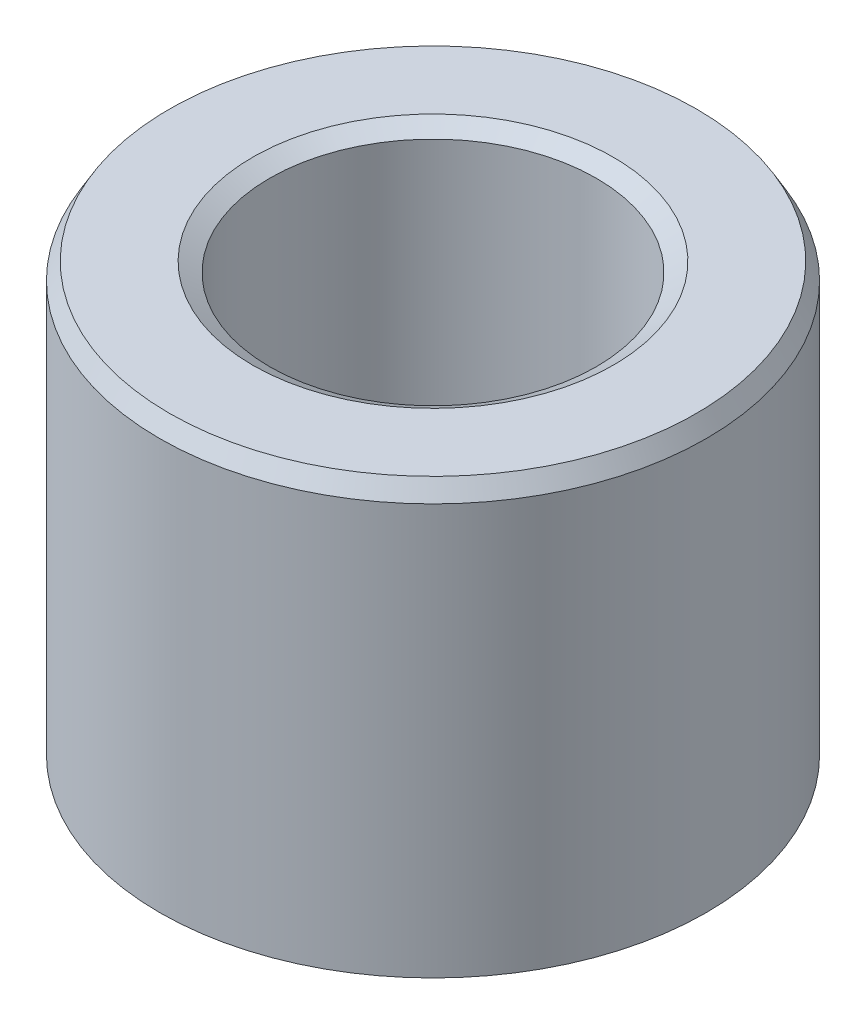
from build123d import *
from OCP.BRepFilletAPI import BRepFilletAPI_MakeChamfer

# Parameters (mm, degrees)
SKETCH1_R           = 32.5
BOSS_EXTRUDE1_DEPTH = 51.987076239
SKETCH2_R           = 19.418426335
CUT_EXTRUDE1_DEPTH  = 70.391325797
CHAMFER1_SIZE       = 2.013413369
CHAMFER1_SIZE2      = 1.162444751


with BuildPart() as part:
    # Sketch1 → Boss-Extrude1 (new body)
    with BuildSketch(Plane(origin=(0, 0, 0), x_dir=(1, 0, 0), z_dir=(0, 1, 0))):
        Circle(SKETCH1_R)
    extrude(amount=BOSS_EXTRUDE1_DEPTH)

    # Sketch2 → Cut-Extrude1 (cut, through all)
    with BuildSketch(Plane(origin=(0, 0, 0), x_dir=(1, 0, 0), z_dir=(0, 1, 0))):
        Circle(SKETCH2_R)
    extrude(amount=CUT_EXTRUDE1_DEPTH, mode=Mode.SUBTRACT)

    # Chamfer1: one chamfer whose edges measure the first distance from different faces: ONE call of the kernel's chamfer builder (chamfer() names one face for all edges)
    chamfer1_edges_1 = [part.edges().sort_by_distance(p)[0] for p in [
        (-19.418426335, 51.987076239, 0),
    ]]
    chamfer1_side_1 = [part.faces().sort_by_distance(p)[0] for p in [
        (-31.580761184, 51.987076239, 0),
    ]]
    chamfer1_edges_2 = [part.edges().sort_by_distance(p)[0] for p in [
        (-19.418426335, 0, 0),
    ]]
    chamfer1_side_2 = [part.faces().sort_by_distance(p)[0] for p in [
        (-19.418426335, 25.99353812, 0),
    ]]
    chamfer1_edges_3 = [part.edges().sort_by_distance(p)[0] for p in [
        (-32.5, 0, 0),
    ]]
    chamfer1_side_3 = [part.faces().sort_by_distance(p)[0] for p in [
        (-31.580761184, 0, 0),
    ]]
    chamfer1_edges_4 = [part.edges().sort_by_distance(p)[0] for p in [
        (-32.5, 51.987076239, 0),
    ]]
    chamfer1_side_4 = [part.faces().sort_by_distance(p)[0] for p in [
        (-32.5, 25.99353812, 0),
    ]]
    chamfer1 = BRepFilletAPI_MakeChamfer(part.part.solid().wrapped)
    for e in chamfer1_edges_1:
        chamfer1.Add(CHAMFER1_SIZE, CHAMFER1_SIZE2, e.wrapped, chamfer1_side_1[0].wrapped)  # the first distance lies on this face
    for e in chamfer1_edges_2:
        chamfer1.Add(CHAMFER1_SIZE, CHAMFER1_SIZE2, e.wrapped, chamfer1_side_2[0].wrapped)  # the first distance lies on this face
    for e in chamfer1_edges_3:
        chamfer1.Add(CHAMFER1_SIZE, CHAMFER1_SIZE2, e.wrapped, chamfer1_side_3[0].wrapped)  # the first distance lies on this face
    for e in chamfer1_edges_4:
        chamfer1.Add(CHAMFER1_SIZE, CHAMFER1_SIZE2, e.wrapped, chamfer1_side_4[0].wrapped)  # the first distance lies on this face
    add(Compound.cast(chamfer1.Shape()), mode=Mode.REPLACE)


solid = part.part
